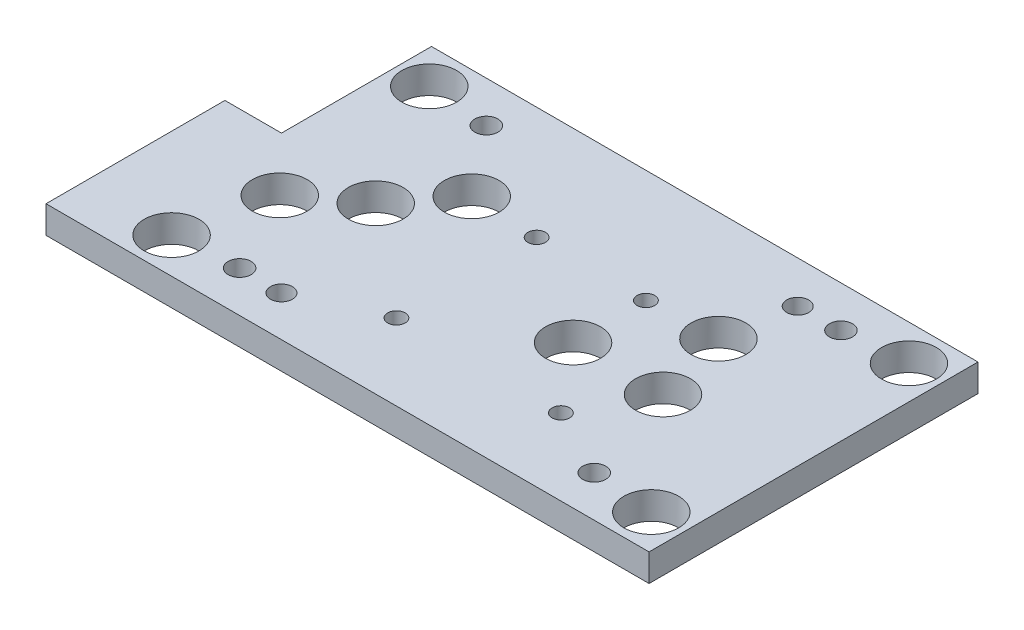
from build123d import *

# Parameters (mm, degrees)
SKETCH1_W             = 220
SKETCH1_H             = 120
BOSS_EXTRUDE1_DEPTH   = 10
CUT_EXTRUDE1_REACH    = 127.698
SKETCH2_W             = 20.632503002
SKETCH2_H             = 54.730004003
CUT_EXTRUDE2_REACH    = 127.698
SKETCH3_R             = 10
F_8_0MM_DOWEL_HOLE1_D = 8
M8_CLEARANCE_HOLE1_D  = 8.4
M6_CLEARANCE_HOLE1_D  = 6.4


with BuildPart() as part:
    # Sketch1 → Boss-Extrude1 (new body)
    with BuildSketch(Plane(origin=(0, 0, 0), x_dir=(1, 0, 0), z_dir=(0, 1, 0))):
        Rectangle(SKETCH1_W, SKETCH1_H)
    extrude(amount=-BOSS_EXTRUDE1_DEPTH)

    # Sketch2 → Cut-Extrude1 (cut, up to next)
    with BuildSketch(Plane(origin=(0, 0, 0), x_dir=(1, 0, 0), z_dir=(0, 1, 0)), mode=Mode.PRIVATE) as cut_extrude1_sk1:
        with Locations((-99.683748499, 32.634997999)):
            Rectangle(SKETCH2_W, SKETCH2_H)
    cut_extrude1_tool1 = extrude(cut_extrude1_sk1.sketch, amount=-CUT_EXTRUDE1_REACH, mode=Mode.PRIVATE) & part.part
    add(cut_extrude1_tool1.solids().sort_by_distance((-99.683748, 0, -32.634998))[0], mode=Mode.SUBTRACT)

    # Sketch3 → Cut-Extrude2 (cut, up to next)
    with BuildSketch(Plane(origin=(0, 0, 0), x_dir=(1, 0, 0), z_dir=(0, 1, 0)), mode=Mode.PRIVATE) as cut_extrude2_sk1:
        with Locations((97.816251501, -47)):
            Circle(SKETCH3_R)
    cut_extrude2_tool1 = extrude(cut_extrude2_sk1.sketch, amount=-CUT_EXTRUDE2_REACH, mode=Mode.PRIVATE) & part.part
    # Sketch3 → Cut-Extrude2 (cut, up to next)
    with BuildSketch(Plane(origin=(0, 0, 0), x_dir=(1, 0, 0), z_dir=(0, 1, 0)), mode=Mode.PRIVATE) as cut_extrude2_sk2:
        with Locations((-77.183748499, -47)):
            Circle(SKETCH3_R)
    cut_extrude2_tool2 = extrude(cut_extrude2_sk2.sketch, amount=-CUT_EXTRUDE2_REACH, mode=Mode.PRIVATE) & part.part
    # Sketch3 → Cut-Extrude2 (cut, up to next)
    with BuildSketch(Plane(origin=(0, 0, 0), x_dir=(1, 0, 0), z_dir=(0, 1, 0)), mode=Mode.PRIVATE) as cut_extrude2_sk3:
        with Locations((-70, -14.72)):
            Circle(SKETCH3_R)
    cut_extrude2_tool3 = extrude(cut_extrude2_sk3.sketch, amount=-CUT_EXTRUDE2_REACH, mode=Mode.PRIVATE) & part.part
    # Sketch3 → Cut-Extrude2 (cut, up to next)
    with BuildSketch(Plane(origin=(0, 0, 0), x_dir=(1, 0, 0), z_dir=(0, 1, 0)), mode=Mode.PRIVATE) as cut_extrude2_sk4:
        with Locations((-50, 0.28)):
            Circle(SKETCH3_R)
    cut_extrude2_tool4 = extrude(cut_extrude2_sk4.sketch, amount=-CUT_EXTRUDE2_REACH, mode=Mode.PRIVATE) & part.part
    # Sketch3 → Cut-Extrude2 (cut, up to next)
    with BuildSketch(Plane(origin=(0, 0, 0), x_dir=(1, 0, 0), z_dir=(0, 1, 0)), mode=Mode.PRIVATE) as cut_extrude2_sk5:
        with Locations((30, -7.72)):
            Circle(SKETCH3_R)
    cut_extrude2_tool5 = extrude(cut_extrude2_sk5.sketch, amount=-CUT_EXTRUDE2_REACH, mode=Mode.PRIVATE) & part.part
    # Sketch3 → Cut-Extrude2 (cut, up to next)
    with BuildSketch(Plane(origin=(0, 0, 0), x_dir=(1, 0, 0), z_dir=(0, 1, 0)), mode=Mode.PRIVATE) as cut_extrude2_sk6:
        with Locations((62.816251501, -7.72)):
            Circle(SKETCH3_R)
    cut_extrude2_tool6 = extrude(cut_extrude2_sk6.sketch, amount=-CUT_EXTRUDE2_REACH, mode=Mode.PRIVATE) & part.part
    # Sketch3 → Cut-Extrude2 (cut, up to next)
    with BuildSketch(Plane(origin=(0, 0, 0), x_dir=(1, 0, 0), z_dir=(0, 1, 0)), mode=Mode.PRIVATE) as cut_extrude2_sk7:
        with Locations((55.316251501, 20)):
            Circle(SKETCH3_R)
    cut_extrude2_tool7 = extrude(cut_extrude2_sk7.sketch, amount=-CUT_EXTRUDE2_REACH, mode=Mode.PRIVATE) & part.part
    # Sketch3 → Cut-Extrude2 (cut, up to next)
    with BuildSketch(Plane(origin=(0, 0, 0), x_dir=(1, 0, 0), z_dir=(0, 1, 0)), mode=Mode.PRIVATE) as cut_extrude2_sk8:
        with Locations((97.816251501, 47)):
            Circle(SKETCH3_R)
    cut_extrude2_tool8 = extrude(cut_extrude2_sk8.sketch, amount=-CUT_EXTRUDE2_REACH, mode=Mode.PRIVATE) & part.part
    # Sketch3 → Cut-Extrude2 (cut, up to next)
    with BuildSketch(Plane(origin=(0, 0, 0), x_dir=(1, 0, 0), z_dir=(0, 1, 0)), mode=Mode.PRIVATE) as cut_extrude2_sk9:
        with Locations((-34.683748499, 20)):
            Circle(SKETCH3_R)
    cut_extrude2_tool9 = extrude(cut_extrude2_sk9.sketch, amount=-CUT_EXTRUDE2_REACH, mode=Mode.PRIVATE) & part.part
    # Sketch3 → Cut-Extrude2 (cut, up to next)
    with BuildSketch(Plane(origin=(0, 0, 0), x_dir=(1, 0, 0), z_dir=(0, 1, 0)), mode=Mode.PRIVATE) as cut_extrude2_sk10:
        with Locations((-77.183748499, 47)):
            Circle(SKETCH3_R)
    cut_extrude2_tool10 = extrude(cut_extrude2_sk10.sketch, amount=-CUT_EXTRUDE2_REACH, mode=Mode.PRIVATE) & part.part
    add(cut_extrude2_tool1.solids().sort_by_distance((97.816252, 0, 47))[0], mode=Mode.SUBTRACT)
    add(cut_extrude2_tool2.solids().sort_by_distance((-77.183748, 0, 47))[0], mode=Mode.SUBTRACT)
    add(cut_extrude2_tool3.solids().sort_by_distance((-70, 0, 14.72))[0], mode=Mode.SUBTRACT)
    add(cut_extrude2_tool4.solids().sort_by_distance((-50, 0, -0.28))[0], mode=Mode.SUBTRACT)
    add(cut_extrude2_tool5.solids().sort_by_distance((30, 0, 7.72))[0], mode=Mode.SUBTRACT)
    add(cut_extrude2_tool6.solids().sort_by_distance((62.816252, 0, 7.72))[0], mode=Mode.SUBTRACT)
    add(cut_extrude2_tool7.solids().sort_by_distance((55.316252, 0, -20))[0], mode=Mode.SUBTRACT)
    add(cut_extrude2_tool8.solids().sort_by_distance((97.816252, 0, -47))[0], mode=Mode.SUBTRACT)
    add(cut_extrude2_tool9.solids().sort_by_distance((-34.683748, 0, -20))[0], mode=Mode.SUBTRACT)
    add(cut_extrude2_tool10.solids().sort_by_distance((-77.183748, 0, -47))[0], mode=Mode.SUBTRACT)

    # Ø8.0mm Dowel Hole1 (through all)
    with Locations(Plane(origin=(0, 0, 0), x_dir=(1, 0, 0), z_dir=(0, 1, 0))):
        with Locations((-38.867496998, -45.241024981), (59.5, 44.728378806)):
            Hole(F_8_0MM_DOWEL_HOLE1_D / 2)

    # M8 Clearance Hole1 (through all)
    with Locations(Plane(origin=(0, 0, 0), x_dir=(1, 0, 0), z_dir=(0, 1, 0))):
        with Locations((-54.367496998, 45), (75, 45), (75, -45), (-54.367496998, -45)):
            Hole(M8_CLEARANCE_HOLE1_D / 2)

    # M6 Clearance Hole1 (through all)
    with Locations(Plane(origin=(0, 0, 0), x_dir=(1, 0, 0), z_dir=(0, 1, 0))):
        with Locations((30, 18.86), (-9.875, 18.86), (-10, -32.16), (50, -32.16)):
            Hole(M6_CLEARANCE_HOLE1_D / 2)


solid = part.part
